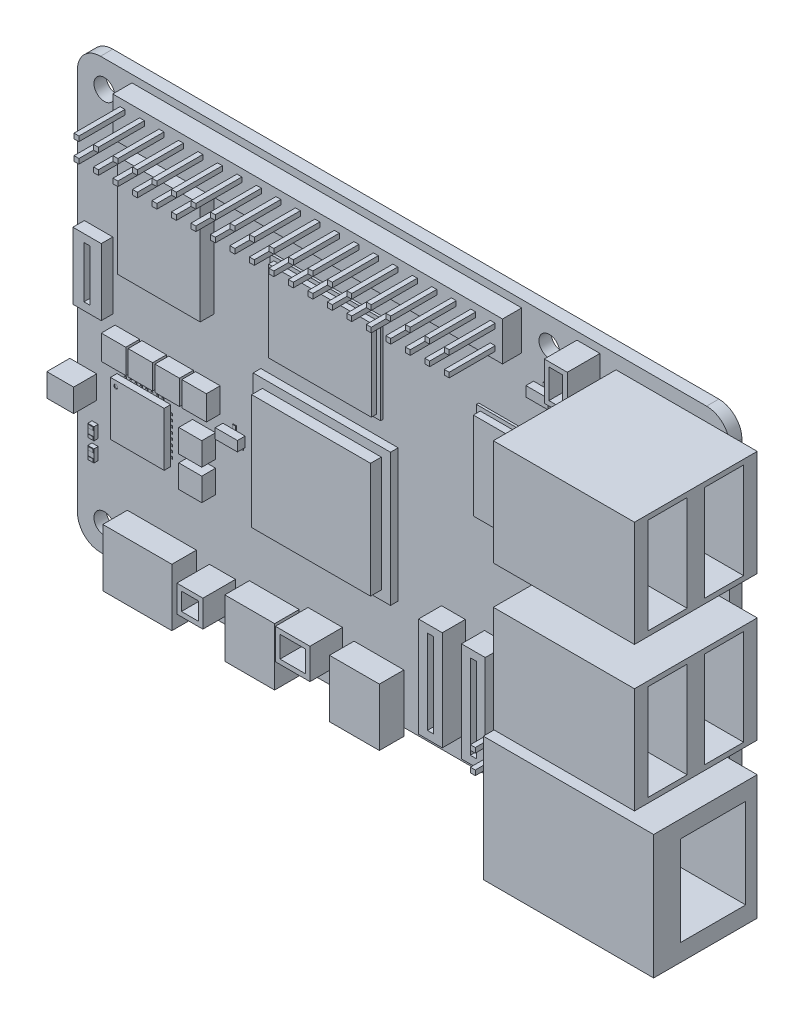
from build123d import *

# Parameters (mm, degrees)
PCB_DEPTH              = 1.6
SKETCH2_W              = 50.8
SKETCH2_H              = 5.08
SKETCH2_W_2            = 5.08
HEADER_BLOCKS_DEPTH    = 2.5
SKETCH3_W              = 0.64
SKETCH3_H              = 0.64
HEADER_PINS_DEPTH      = 6
SKETCH4_W              = 0.25
SKETCH4_H              = 0.3
SKETCH4_W_2            = 0.3
SKETCH4_H_2            = 0.25
PARTS_ADD00_DEPTH      = 0.05
SKETCH5_W              = 0.4
SKETCH5_H              = 0.7
PARTS_ADD01_DEPTH      = 0.1
SKETCH6_W              = 14.4
SKETCH6_H              = 11.6
SKETCH6_W_2            = 12.9
SKETCH6_H_2            = 12.4
PARTS_ADD02_DEPTH      = 0.3
SKETCH7_W              = 0.8
SKETCH7_H              = 1.6
PARTS_ADD03_DEPTH      = 0.55
PARTS_ADD04_DEPTH      = 0.9
SKETCH9_W              = 17.9
SKETCH9_H              = 17.3
PARTS_ADD05_DEPTH      = 1
SKETCH10_W             = 3.7
SKETCH10_H             = 8.7
PARTS_ADD06_DEPTH      = 1.5
SKETCH11_W             = 10.8
SKETCH11_H             = 13.3
SKETCH11_W_2           = 3.2
SKETCH11_H_2           = 3.2
SKETCH11_W_3           = 3
SKETCH11_H_3           = 3
PARTS_ADD07_DEPTH      = 1.8
SKETCH12_W             = 3.1
SKETCH12_H             = 13
SKETCH12_W_2           = 3.5
SKETCH12_H_2           = 3
PARTS_ADD08_DEPTH      = 3
SKETCH13_W             = 6.5
SKETCH13_H             = 7.5
SKETCH13_W_2           = 9
PARTS_ADD09_DEPTH      = 3.2
SKETCH14_W             = 3
SKETCH14_H             = 5
SKETCH14_W_2           = 4.5
SKETCH14_H_2           = 4
SKETCH14_W_3           = 3.4
SKETCH14_H_3           = 3.5
PARTS_ADD10_DEPTH      = 4.25
SKETCH15_W             = 22.2
SKETCH15_H             = 16.2
PARTS_ADD11_DEPTH      = 13.5
SKETCH16_W             = 18.4
SKETCH16_H             = 13.8
PARTS_ADD12_DEPTH      = 16
SKETCH17_W             = 7
SKETCH17_H             = 7
PARTS_ADD13_DEPTH      = 0.85
SKETCH18_W             = 4
SKETCH18_H             = 4.5
PARTS_ADD14_DEPTH      = 0.95
SKETCH19_W             = 2.9
SKETCH19_H             = 1.3
PARTS_ADD15_DEPTH      = 1
SKETCH20_W             = 13.4
SKETCH20_H             = 10.6
PARTS_ADD16_DEPTH      = 0.7
SKETCH21_W             = 11.9
SKETCH21_H             = 11.4
PARTS_ADD17_DEPTH      = 0.9
SKETCH22_W             = 0.7
SKETCH22_H             = 0.4
PARTS_ADD18_DEPTH      = 0.05
SKETCH23_W             = 15.5
SKETCH23_H             = 15
PARTS_ADD19_DEPTH      = 1.4
SKETCH24_W             = 5.1
SKETCH24_H             = 12.5
PARTS_CUT00_DEPTH      = 14
SKETCH25_W             = 8.5
SKETCH25_H             = 11.7
PARTS_CUT01_DEPTH      = 18
SKETCH26_W             = 5.5
SKETCH26_H             = 2
PARTS_CUT02_DEPTH      = 7
SKETCH27_R             = 0.25
PARTS_CUT03_DEPTH      = 0.1
SKETCH28_R             = 0.25
PARTS_CUT04_DEPTH      = 0.1
SKETCH29_W             = 0.8
SKETCH29_H             = 6.7
PARTS_CUT05_DEPTH      = 1
SKETCH30_W             = 0.8
SKETCH30_H             = 11
PARTS_CUT06_DEPTH      = 2.5
SKETCH31_W             = 1.8
SKETCH31_H             = 3.8
SKETCH31_W_2           = 3.3
SKETCH31_H_2           = 2.8
SKETCH31_W_3           = 2.2
SKETCH31_H_3           = 2.3
PARTS_CUT07_DEPTH      = 3.25
MOUNT_HOLES_DEPTH      = 107.281324794
MOUNT_HOLES_DEPTH_BACK = 107.281324794
SKETCH32_R             = 1.35


with BuildPart() as part:
    # Sketch1 → PCB (new body)
    with BuildSketch(Plane.XY):
        with BuildLine():
            Line((3, 0), (82, 0))
            ThreePointArc((82, 0), (84.121320344, 0.878679656), (85, 3))
            Line((85, 3), (85, 53))
            ThreePointArc((85, 53), (84.121320344, 55.121320344), (82, 56))
            Line((82, 56), (3, 56))
            ThreePointArc((3, 56), (0.878679656, 55.121320344), (0, 53))
            Line((0, 53), (0, 3))
            ThreePointArc((0, 3), (0.878679656, 0.878679656), (3, 0))
        make_face()
    extrude(amount=PCB_DEPTH)

    # Sketch2 → Header_Blocks (add)
    with BuildSketch(Plane.XY.offset(1.6)):
        with Locations((32.5, 52.5)):
            Rectangle(SKETCH2_W, SKETCH2_H)
        with Locations((61.3, 9.3)):
            Rectangle(SKETCH2_W_2, SKETCH2_H)
    extrude(amount=HEADER_BLOCKS_DEPTH)

    # Sketch3 → Header_Pins (add)
    with BuildSketch(Plane.XY.offset(4.1)):
        with Locations((8.37, 51.23)):
            Rectangle(SKETCH3_W, SKETCH3_H)
        with Locations((8.37, 53.77)):
            Rectangle(SKETCH3_W, SKETCH3_H)
        with Locations((10.91, 51.23)):
            Rectangle(SKETCH3_W, SKETCH3_H)
        with Locations((10.91, 53.77)):
            Rectangle(SKETCH3_W, SKETCH3_H)
        with Locations((13.45, 51.23)):
            Rectangle(SKETCH3_W, SKETCH3_H)
        with Locations((13.45, 53.77)):
            Rectangle(SKETCH3_W, SKETCH3_H)
        with Locations((15.99, 51.23)):
            Rectangle(SKETCH3_W, SKETCH3_H)
        with Locations((15.99, 53.77)):
            Rectangle(SKETCH3_W, SKETCH3_H)
        with Locations((18.53, 51.23)):
            Rectangle(SKETCH3_W, SKETCH3_H)
        with Locations((18.53, 53.77)):
            Rectangle(SKETCH3_W, SKETCH3_H)
        with Locations((21.07, 51.23)):
            Rectangle(SKETCH3_W, SKETCH3_H)
        with Locations((21.07, 53.77)):
            Rectangle(SKETCH3_W, SKETCH3_H)
        with Locations((23.61, 51.23)):
            Rectangle(SKETCH3_W, SKETCH3_H)
        with Locations((23.61, 53.77)):
            Rectangle(SKETCH3_W, SKETCH3_H)
        with Locations((26.15, 51.23)):
            Rectangle(SKETCH3_W, SKETCH3_H)
        with Locations((26.15, 53.77)):
            Rectangle(SKETCH3_W, SKETCH3_H)
        with Locations((28.69, 51.23)):
            Rectangle(SKETCH3_W, SKETCH3_H)
        with Locations((28.69, 53.77)):
            Rectangle(SKETCH3_W, SKETCH3_H)
        with Locations((31.23, 51.23)):
            Rectangle(SKETCH3_W, SKETCH3_H)
        with Locations((31.23, 53.77)):
            Rectangle(SKETCH3_W, SKETCH3_H)
        with Locations((33.77, 51.23)):
            Rectangle(SKETCH3_W, SKETCH3_H)
        with Locations((33.77, 53.77)):
            Rectangle(SKETCH3_W, SKETCH3_H)
        with Locations((36.31, 51.23)):
            Rectangle(SKETCH3_W, SKETCH3_H)
        with Locations((36.31, 53.77)):
            Rectangle(SKETCH3_W, SKETCH3_H)
        with Locations((38.85, 51.23)):
            Rectangle(SKETCH3_W, SKETCH3_H)
        with Locations((38.85, 53.77)):
            Rectangle(SKETCH3_W, SKETCH3_H)
        with Locations((41.39, 51.23)):
            Rectangle(SKETCH3_W, SKETCH3_H)
        with Locations((41.39, 53.77)):
            Rectangle(SKETCH3_W, SKETCH3_H)
        with Locations((43.93, 51.23)):
            Rectangle(SKETCH3_W, SKETCH3_H)
        with Locations((43.93, 53.77)):
            Rectangle(SKETCH3_W, SKETCH3_H)
        with Locations((46.47, 51.23)):
            Rectangle(SKETCH3_W, SKETCH3_H)
        with Locations((46.47, 53.77)):
            Rectangle(SKETCH3_W, SKETCH3_H)
        with Locations((49.01, 51.23)):
            Rectangle(SKETCH3_W, SKETCH3_H)
        with Locations((49.01, 53.77)):
            Rectangle(SKETCH3_W, SKETCH3_H)
        with Locations((51.55, 51.23)):
            Rectangle(SKETCH3_W, SKETCH3_H)
        with Locations((51.55, 53.77)):
            Rectangle(SKETCH3_W, SKETCH3_H)
        with Locations((54.09, 51.23)):
            Rectangle(SKETCH3_W, SKETCH3_H)
        with Locations((54.09, 53.77)):
            Rectangle(SKETCH3_W, SKETCH3_H)
        with Locations((56.63, 51.23)):
            Rectangle(SKETCH3_W, SKETCH3_H)
        with Locations((56.63, 53.77)):
            Rectangle(SKETCH3_W, SKETCH3_H)
        with Locations((60.03, 8.03)):
            Rectangle(SKETCH3_W, SKETCH3_H)
        with Locations((60.03, 10.57)):
            Rectangle(SKETCH3_W, SKETCH3_H)
        with Locations((62.57, 8.03)):
            Rectangle(SKETCH3_W, SKETCH3_H)
        with Locations((62.57, 10.57)):
            Rectangle(SKETCH3_W, SKETCH3_H)
    extrude(amount=HEADER_PINS_DEPTH)

    # Sketch4 → Parts_add00 (add)
    with BuildSketch(Plane.XY.offset(1.6)):
        with Locations((6.25, 14.25)):
            Rectangle(SKETCH4_W, SKETCH4_H)
        with Locations((5.15, 15.35)):
            Rectangle(SKETCH4_W_2, SKETCH4_H_2)
        with Locations((6.25, 21.35)):
            Rectangle(SKETCH4_W, SKETCH4_H)
        with Locations((12.25, 15.35)):
            Rectangle(SKETCH4_W_2, SKETCH4_H_2)
        with Locations((6.95, 14.25)):
            Rectangle(SKETCH4_W, SKETCH4_H)
        with Locations((5.15, 16.05)):
            Rectangle(SKETCH4_W_2, SKETCH4_H_2)
        with Locations((6.95, 21.35)):
            Rectangle(SKETCH4_W, SKETCH4_H)
        with Locations((12.25, 16.05)):
            Rectangle(SKETCH4_W_2, SKETCH4_H_2)
        with Locations((7.65, 14.25)):
            Rectangle(SKETCH4_W, SKETCH4_H)
        with Locations((5.15, 16.75)):
            Rectangle(SKETCH4_W_2, SKETCH4_H_2)
        with Locations((7.65, 21.35)):
            Rectangle(SKETCH4_W, SKETCH4_H)
        with Locations((12.25, 16.75)):
            Rectangle(SKETCH4_W_2, SKETCH4_H_2)
        with Locations((8.35, 14.25)):
            Rectangle(SKETCH4_W, SKETCH4_H)
        with Locations((5.15, 17.45)):
            Rectangle(SKETCH4_W_2, SKETCH4_H_2)
        with Locations((8.35, 21.35)):
            Rectangle(SKETCH4_W, SKETCH4_H)
        with Locations((12.25, 17.45)):
            Rectangle(SKETCH4_W_2, SKETCH4_H_2)
        with Locations((9.05, 14.25)):
            Rectangle(SKETCH4_W, SKETCH4_H)
        with Locations((5.15, 18.15)):
            Rectangle(SKETCH4_W_2, SKETCH4_H_2)
        with Locations((9.05, 21.35)):
            Rectangle(SKETCH4_W, SKETCH4_H)
        with Locations((12.25, 18.15)):
            Rectangle(SKETCH4_W_2, SKETCH4_H_2)
        with Locations((9.75, 14.25)):
            Rectangle(SKETCH4_W, SKETCH4_H)
        with Locations((5.15, 18.85)):
            Rectangle(SKETCH4_W_2, SKETCH4_H_2)
        with Locations((9.75, 21.35)):
            Rectangle(SKETCH4_W, SKETCH4_H)
        with Locations((12.25, 18.85)):
            Rectangle(SKETCH4_W_2, SKETCH4_H_2)
        with Locations((10.45, 14.25)):
            Rectangle(SKETCH4_W, SKETCH4_H)
        with Locations((5.15, 19.55)):
            Rectangle(SKETCH4_W_2, SKETCH4_H_2)
        with Locations((10.45, 21.35)):
            Rectangle(SKETCH4_W, SKETCH4_H)
        with Locations((12.25, 19.55)):
            Rectangle(SKETCH4_W_2, SKETCH4_H_2)
        with Locations((11.15, 14.25)):
            Rectangle(SKETCH4_W, SKETCH4_H)
        with Locations((5.15, 20.25)):
            Rectangle(SKETCH4_W_2, SKETCH4_H_2)
        with Locations((11.15, 21.35)):
            Rectangle(SKETCH4_W, SKETCH4_H)
        with Locations((12.25, 20.25)):
            Rectangle(SKETCH4_W_2, SKETCH4_H_2)
        with Locations((66.4, 43.3)):
            Rectangle(SKETCH4_W, SKETCH4_H)
        with Locations((65.35, 44.6)):
            Rectangle(SKETCH4_W_2, SKETCH4_H_2)
        with Locations((66.4, 47.9)):
            Rectangle(SKETCH4_W, SKETCH4_H)
        with Locations((69.45, 44.6)):
            Rectangle(SKETCH4_W_2, SKETCH4_H_2)
        with Locations((67.066666667, 43.3)):
            Rectangle(SKETCH4_W, SKETCH4_H)
        with Locations((65.35, 45.266666667)):
            Rectangle(SKETCH4_W_2, SKETCH4_H_2)
        with Locations((67.066666667, 47.9)):
            Rectangle(SKETCH4_W, SKETCH4_H)
        with Locations((69.45, 45.266666667)):
            Rectangle(SKETCH4_W_2, SKETCH4_H_2)
        with Locations((67.733333333, 43.3)):
            Rectangle(SKETCH4_W, SKETCH4_H)
        with Locations((65.35, 45.933333333)):
            Rectangle(SKETCH4_W_2, SKETCH4_H_2)
        with Locations((67.733333333, 47.9)):
            Rectangle(SKETCH4_W, SKETCH4_H)
        with Locations((69.45, 45.933333333)):
            Rectangle(SKETCH4_W_2, SKETCH4_H_2)
        with Locations((68.4, 43.3)):
            Rectangle(SKETCH4_W, SKETCH4_H)
        with Locations((65.35, 46.6)):
            Rectangle(SKETCH4_W_2, SKETCH4_H_2)
        with Locations((68.4, 47.9)):
            Rectangle(SKETCH4_W, SKETCH4_H)
        with Locations((69.45, 46.6)):
            Rectangle(SKETCH4_W_2, SKETCH4_H_2)
    extrude(amount=PARTS_ADD00_DEPTH)

    # Sketch5 → Parts_add01 (add)
    with BuildSketch(Plane.XY.offset(1.6)):
        with Locations((19.55, 21.2)):
            Rectangle(SKETCH5_W, SKETCH5_H)
        with Locations((21.45, 21.2)):
            Rectangle(SKETCH5_W, SKETCH5_H)
        with Locations((20.5, 22.8)):
            Rectangle(SKETCH5_W, SKETCH5_H)
        with Locations((58.55, 17.2)):
            Rectangle(SKETCH5_W, SKETCH5_H)
        with Locations((60.45, 17.2)):
            Rectangle(SKETCH5_W, SKETCH5_H)
        with Locations((59.5, 18.8)):
            Rectangle(SKETCH5_W, SKETCH5_H)
        with Locations((60.05, 46.2)):
            Rectangle(SKETCH5_W, SKETCH5_H)
        with Locations((61.95, 46.2)):
            Rectangle(SKETCH5_W, SKETCH5_H)
        with Locations((61, 47.8)):
            Rectangle(SKETCH5_W, SKETCH5_H)
    extrude(amount=PARTS_ADD01_DEPTH)

    # Sketch6 → Parts_add02 (add)
    with BuildSketch(Plane.XY.offset(1.6)):
        with Locations((32.6, 39.2)):
            Rectangle(SKETCH6_W, SKETCH6_H)
        with Locations((58.75, 35.3)):
            Rectangle(SKETCH6_W_2, SKETCH6_H_2)
    extrude(amount=PARTS_ADD02_DEPTH)

    # Sketch7 → Parts_add03 (add)
    with BuildSketch(Plane.XY.offset(1.6)):
        with Locations((2.3, 11)):
            Rectangle(SKETCH7_W, SKETCH7_H)
        with Locations((2.3, 13.5)):
            Rectangle(SKETCH7_W, SKETCH7_H)
    extrude(amount=PARTS_ADD03_DEPTH)

    # Sketch8 → Parts_add04 (add)
    with BuildSketch(Plane.XY.offset(1.6)):
        Polygon((62.7, 19.918019485), (65.881980515, 23.1), (62.7, 26.281980515), (59.518019485, 23.1), align=None)
    extrude(amount=PARTS_ADD04_DEPTH)

    # Sketch9 → Parts_add05 (add)
    with BuildSketch(Plane.XY.offset(1.6)):
        with Locations((32.85, 22.55)):
            Rectangle(SKETCH9_W, SKETCH9_H)
    extrude(amount=PARTS_ADD05_DEPTH)

    # Sketch10 → Parts_add06 (add)
    with BuildSketch(Plane.XY.offset(1.6)):
        with Locations((2.75, 32.05)):
            Rectangle(SKETCH10_W, SKETCH10_H)
    extrude(amount=PARTS_ADD06_DEPTH)

    # Sketch11 → Parts_add07 (add)
    with BuildSketch(Plane.XY.offset(1.6)):
        with Locations((12.4, 40.95)):
            Rectangle(SKETCH11_W, SKETCH11_H)
        with Locations((6.5, 25)):
            Rectangle(SKETCH11_W_2, SKETCH11_H_2)
        with Locations((10, 25)):
            Rectangle(SKETCH11_W_2, SKETCH11_H_2)
        with Locations((13.5, 25)):
            Rectangle(SKETCH11_W_2, SKETCH11_H_2)
        with Locations((17, 25)):
            Rectangle(SKETCH11_W_2, SKETCH11_H_2)
        with Locations((16.5, 19.5)):
            Rectangle(SKETCH11_W_3, SKETCH11_H_3)
        with Locations((16.5, 15.5)):
            Rectangle(SKETCH11_W_3, SKETCH11_H_3)
    extrude(amount=PARTS_ADD07_DEPTH)

    # Sketch12 → Parts_add08 (add)
    with BuildSketch(Plane.XY.offset(1.6)):
        with Locations((54.6, 9.7)):
            Rectangle(SKETCH12_W, SKETCH12_H)
        with Locations((49, 9.7)):
            Rectangle(SKETCH12_W, SKETCH12_H)
        with Locations((0.75, 18.4)):
            Rectangle(SKETCH12_W_2, SKETCH12_H_2)
    extrude(amount=PARTS_ADD08_DEPTH)

    # Sketch13 → Parts_add09 (add)
    with BuildSketch(Plane.XY.offset(1.6)):
        with Locations((25.65, 2.75)):
            Rectangle(SKETCH13_W, SKETCH13_H)
        with Locations((39.3, 2.75)):
            Rectangle(SKETCH13_W, SKETCH13_H)
        with Locations((11, 2.75)):
            Rectangle(SKETCH13_W_2, SKETCH13_H)
    extrude(amount=PARTS_ADD09_DEPTH)

    # Sketch14 → Parts_add10 (add)
    with BuildSketch(Plane.XY.offset(1.6)):
        with Locations((66.6, 52.5)):
            Rectangle(SKETCH14_W, SKETCH14_H)
        with Locations((32.3, 5.3)):
            Rectangle(SKETCH14_W_2, SKETCH14_H_2)
        with Locations((18.9, 4)):
            Rectangle(SKETCH14_W_3, SKETCH14_H_3)
    extrude(amount=PARTS_ADD10_DEPTH)

    # Sketch15 → Parts_add11 (add)
    with BuildSketch(Plane.XY.offset(1.6)):
        with Locations((77.5, 9.6)):
            Rectangle(SKETCH15_W, SKETCH15_H)
    extrude(amount=PARTS_ADD11_DEPTH)

    # Sketch16 → Parts_add12 (add)
    with BuildSketch(Plane.XY.offset(1.6)):
        with Locations((79.4, 47.3)):
            Rectangle(SKETCH16_W, SKETCH16_H)
        with Locations((79.4, 28.5)):
            Rectangle(SKETCH16_W, SKETCH16_H)
    extrude(amount=PARTS_ADD12_DEPTH)

    # Sketch17 → Parts_add13 (add)
    with BuildSketch(Plane.XY.offset(1.65)):
        with Locations((8.7, 17.8)):
            Rectangle(SKETCH17_W, SKETCH17_H)
    extrude(amount=PARTS_ADD13_DEPTH)

    # Sketch18 → Parts_add14 (add)
    with BuildSketch(Plane.XY.offset(1.65)):
        with Locations((67.4, 45.6)):
            Rectangle(SKETCH18_W, SKETCH18_H)
    extrude(amount=PARTS_ADD14_DEPTH)

    # Sketch19 → Parts_add15 (add)
    with BuildSketch(Plane.XY.offset(1.7)):
        with Locations((20.5, 22)):
            Rectangle(SKETCH19_W, SKETCH19_H)
        with Locations((59.5, 18)):
            Rectangle(SKETCH19_W, SKETCH19_H)
        with Locations((61, 47)):
            Rectangle(SKETCH19_W, SKETCH19_H)
    extrude(amount=PARTS_ADD15_DEPTH)

    # Sketch20 → Parts_add16 (add)
    with BuildSketch(Plane.XY.offset(1.9)):
        with Locations((32.6, 39.2)):
            Rectangle(SKETCH20_W, SKETCH20_H)
    extrude(amount=PARTS_ADD16_DEPTH)

    # Sketch21 → Parts_add17 (add)
    with BuildSketch(Plane.XY.offset(1.9)):
        with Locations((58.75, 35.3)):
            Rectangle(SKETCH21_W, SKETCH21_H)
    extrude(amount=PARTS_ADD17_DEPTH)

    # Sketch22 → Parts_add18 (add)
    with BuildSketch(Plane.XY.offset(2.15)):
        with Locations((2.3, 10.45)):
            Rectangle(SKETCH22_W, SKETCH22_H)
        with Locations((2.3, 11.55)):
            Rectangle(SKETCH22_W, SKETCH22_H)
        with Locations((2.3, 12.95)):
            Rectangle(SKETCH22_W, SKETCH22_H)
        with Locations((2.3, 14.05)):
            Rectangle(SKETCH22_W, SKETCH22_H)
    extrude(amount=PARTS_ADD18_DEPTH)

    # Sketch23 → Parts_add19 (add)
    with BuildSketch(Plane.XY.offset(2.6)):
        with Locations((32.85, 22.55)):
            Rectangle(SKETCH23_W, SKETCH23_H)
    extrude(amount=PARTS_ADD19_DEPTH)

    # Sketch24 → Parts_cut00 (cut)
    with BuildSketch(Plane(origin=(88.6, 0, 0), x_dir=(0, 0, -1), z_dir=(1, 0, 0))):
        with Locations((-5.92, 47.3)):
            Rectangle(SKETCH24_W, SKETCH24_H)
        with Locations((-13.28, 47.3)):
            Rectangle(SKETCH24_W, SKETCH24_H)
        with Locations((-5.92, 28.5)):
            Rectangle(SKETCH24_W, SKETCH24_H)
        with Locations((-13.28, 28.5)):
            Rectangle(SKETCH24_W, SKETCH24_H)
    extrude(amount=-PARTS_CUT00_DEPTH, mode=Mode.SUBTRACT)

    # Sketch25 → Parts_cut01 (cut)
    with BuildSketch(Plane(origin=(88.6, 0, 0), x_dir=(0, 0, -1), z_dir=(1, 0, 0))):
        with Locations((-7.35, 9.6)):
            Rectangle(SKETCH25_W, SKETCH25_H)
    extrude(amount=-PARTS_CUT01_DEPTH, mode=Mode.SUBTRACT)

    # Sketch26 → Parts_cut02 (cut)
    with BuildSketch(Plane(origin=(0, 6, 0), x_dir=(1, 0, 0), z_dir=(0, 1, 0))):
        with Locations((25.65, -3.2)):
            Rectangle(SKETCH26_W, SKETCH26_H)
        with BuildLine():
            Line((8.1, -1.95), (13.9, -1.95))
            ThreePointArc((13.9, -1.95), (15.15, -3.2), (13.9, -4.45))
            Line((13.9, -4.45), (8.1, -4.45))
            ThreePointArc((8.1, -4.45), (6.85, -3.2), (8.1, -1.95))
        make_face()
        with Locations((39.3, -3.2)):
            Rectangle(SKETCH26_W, SKETCH26_H)
    extrude(amount=-PARTS_CUT02_DEPTH, mode=Mode.SUBTRACT)

    # Sketch27 → Parts_cut03 (cut)
    with BuildSketch(Plane.XY.offset(2.5)):
        with Locations((5.9, 20.6)):
            Circle(SKETCH27_R)
    extrude(amount=-PARTS_CUT03_DEPTH, mode=Mode.SUBTRACT)

    # Sketch28 → Parts_cut04 (cut)
    with BuildSketch(Plane.XY.offset(2.6)):
        with Locations((66.1, 47.15)):
            Circle(SKETCH28_R)
    extrude(amount=-PARTS_CUT04_DEPTH, mode=Mode.SUBTRACT)

    # Sketch29 → Parts_cut05 (cut)
    with BuildSketch(Plane.XY.offset(3.1)):
        with Locations((2.75, 32.05)):
            Rectangle(SKETCH29_W, SKETCH29_H)
    extrude(amount=-PARTS_CUT05_DEPTH, mode=Mode.SUBTRACT)

    # Sketch30 → Parts_cut06 (cut)
    with BuildSketch(Plane.XY.offset(4.6)):
        with Locations((54.6, 9.7)):
            Rectangle(SKETCH30_W, SKETCH30_H)
        with Locations((49, 9.7)):
            Rectangle(SKETCH30_W, SKETCH30_H)
    extrude(amount=-PARTS_CUT06_DEPTH, mode=Mode.SUBTRACT)

    # Sketch31 → Parts_cut07 (cut)
    with BuildSketch(Plane.XY.offset(5.85)):
        with Locations((66.6, 52.5)):
            Rectangle(SKETCH31_W, SKETCH31_H)
        with Locations((32.3, 5.3)):
            Rectangle(SKETCH31_W_2, SKETCH31_H_2)
        with Locations((18.9, 4)):
            Rectangle(SKETCH31_W_3, SKETCH31_H_3)
    extrude(amount=-PARTS_CUT07_DEPTH, mode=Mode.SUBTRACT)

    # Sketch32 → Mount_Holes (cut, two sides: drawn at the far end of the back side and taken through both)
    with BuildSketch(Plane.XY.offset(-MOUNT_HOLES_DEPTH_BACK)):
        with Locations((3.5, 3.5)):
            Circle(SKETCH32_R)
        with Locations((3.5, 52.5)):
            Circle(SKETCH32_R)
        with Locations((61.5, 3.5)):
            Circle(SKETCH32_R)
        with Locations((61.5, 52.5)):
            Circle(SKETCH32_R)
    extrude(amount=MOUNT_HOLES_DEPTH + MOUNT_HOLES_DEPTH_BACK, mode=Mode.SUBTRACT)


solid = part.part
